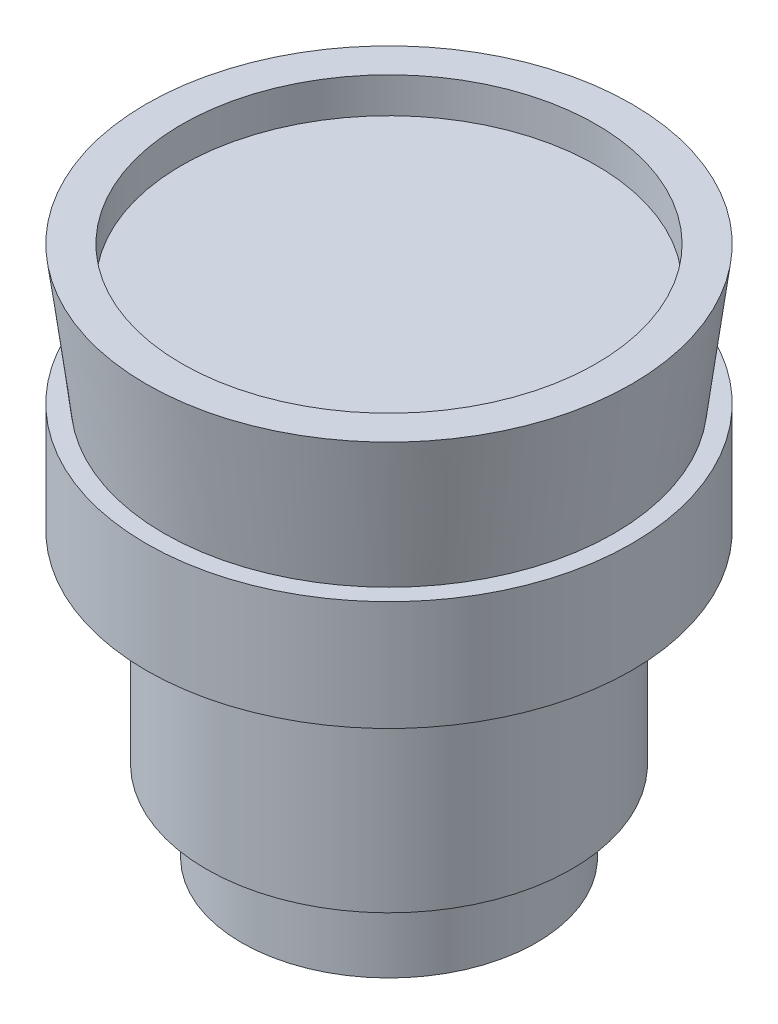
from build123d import *

# Parameters (mm, degrees)
SKETCH2_R          = 14.859
CUT_EXTRUDE1_DEPTH = 2.54


with BuildPart() as part:
    # Sketch1 → Revolve1 (revolve)
    with BuildSketch(Plane(origin=(0, 0, 0), x_dir=(0, 0, -1), z_dir=(1, 0, 0))):
        Polygon((0, 17.78), (-17.399, 17.78), (-16.129, 7.874), (-17.399, 7.874), (-17.399, 0), (-13.1064, 0), (-13.1064, -14.478), (-10.5664, -14.478), (-10.5664, -20.32), (0, -20.32), align=None)
    revolve(axis=Axis((0, 17.78, 0), (0, -1, 0)))

    # Sketch2 → Cut-Extrude1 (cut)
    with BuildSketch(Plane(origin=(0, 17.78, 0), x_dir=(1, 0, 0), z_dir=(0, 1, 0))):
        Circle(SKETCH2_R)
    extrude(amount=-CUT_EXTRUDE1_DEPTH, mode=Mode.SUBTRACT)


solid = part.part
